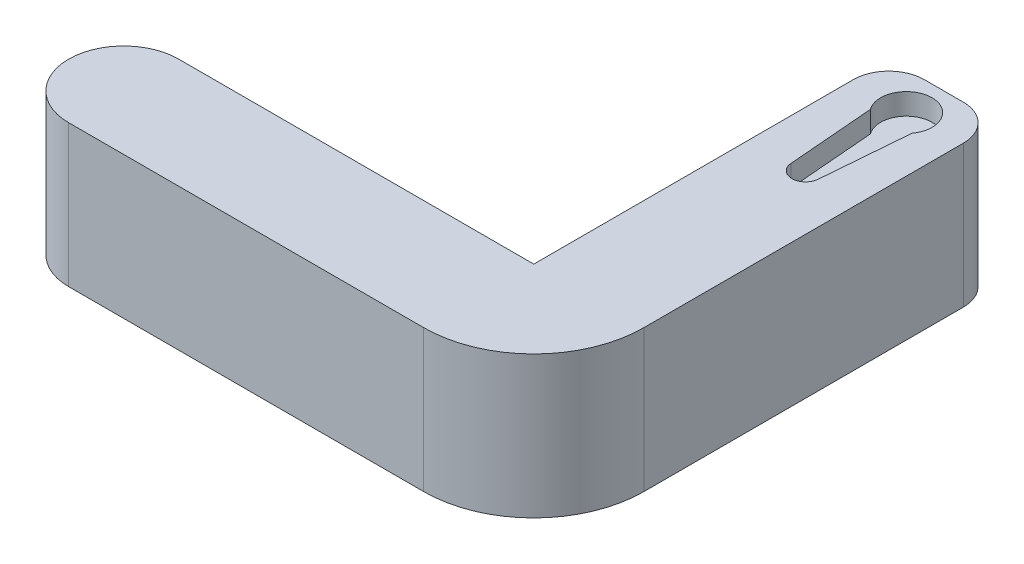
from build123d import *

# Parameters (mm, degrees)
BOSS_EXTRUDE1_DEPTH = 20
CUT_EXTRUDE3_DEPTH  = 3
FILLET1_R           = 5


with BuildPart() as part:
    # Sketch1 → Boss-Extrude1 (new body)
    with BuildSketch(Plane(origin=(0, 0, 0), x_dir=(1, 0, 0), z_dir=(0, 1, 0))):
        with BuildLine():
            Line((0, 7.75), (50, 7.75))
            Line((50, 7.75), (50, 57.75))
            Line((50, 57.75), (65.5, 57.75))
            Line((65.5, 57.75), (65.5, 7.75))
            ThreePointArc((65.5, 7.75), (60.960155108, -3.210155108), (50, -7.75))
            Line((50, -7.75), (0, -7.75))
            ThreePointArc((0, -7.75), (-7.75, 0), (0, 7.75))
        make_face()
    extrude(amount=BOSS_EXTRUDE1_DEPTH)

    # Sketch2 → Cut-Extrude3 (cut)
    with BuildSketch(Plane(origin=(0, 20, 0), x_dir=(1, 0, 0), z_dir=(0, 1, 0))):
        with BuildLine():
            Line((60.671, 50.328213109), (59.673587356, 38.123274344))
            ThreePointArc((59.673587356, 38.123274344), (57.75, 36.350473851), (55.826412644, 38.123274344))
            Line((55.826412644, 38.123274344), (54.829, 50.328213109))
            ThreePointArc((54.829, 50.328213109), (57.75, 56.086473851), (60.671, 50.328213109))
        make_face()
    extrude(amount=-CUT_EXTRUDE3_DEPTH, mode=Mode.SUBTRACT)

    # Fillet1
    fillet1_edges = [part.edges().sort_by_distance(p)[0] for p in [
        (50, 10, -57.75),
        (65.5, 10, -57.75),
    ]]
    fillet(fillet1_edges, radius=FILLET1_R)


solid = part.part
